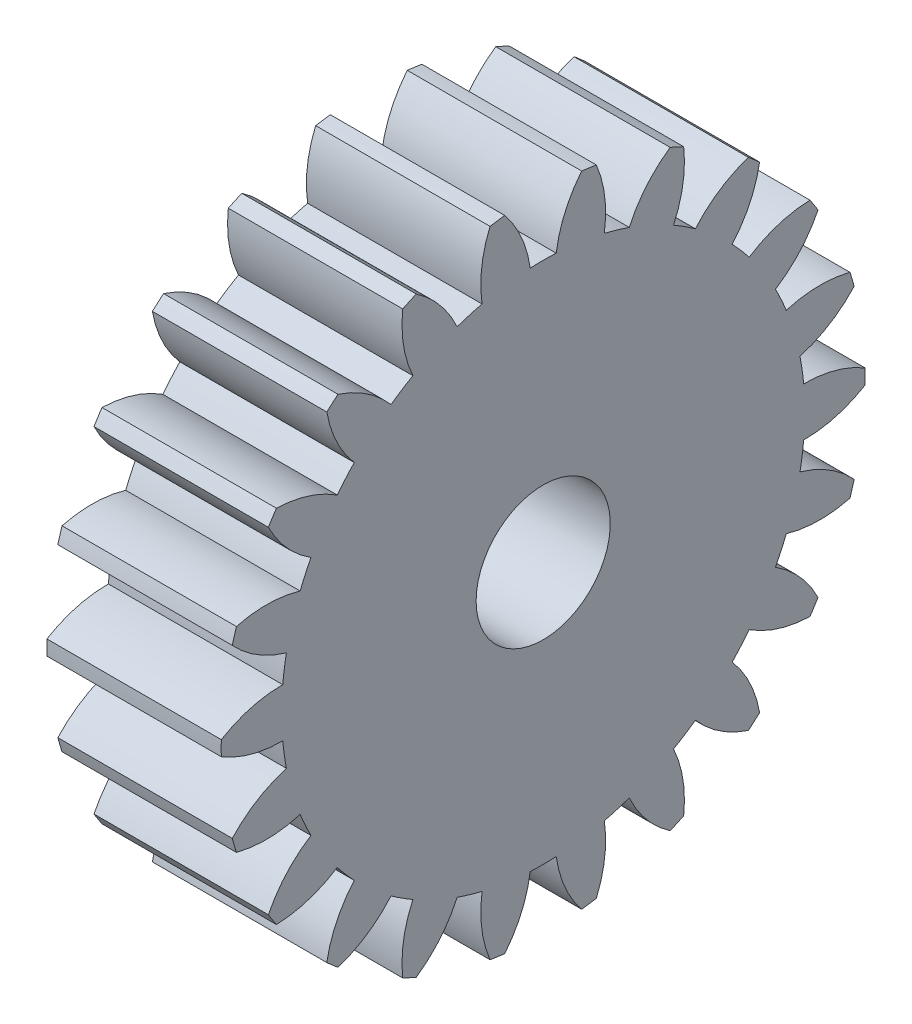
from build123d import *

# Parameters (mm, degrees)
BASPROSKE_W     = 13
BASPROSKE_H     = 24
TOOTHCUT_DEPTH  = 37.345563691
TEETHCUTS_COUNT = 22
TEETHCUTS_ANGLE = 343.636363636
BORSKE_R        = 5
BORE_DEPTH      = 50.0000508
SCALE1_SCALE    = 0.317565217


with BuildPart() as part:
    # BasProSke → Base-Revolve (revolve)
    with BuildSketch(Plane(origin=(0, 0, 0), x_dir=(1, 0, 0), z_dir=(0, 1, 0))):
        with Locations((6.5, 12)):
            Rectangle(BASPROSKE_W, BASPROSKE_H)
    revolve(axis=Axis((-10, 0, 0), (1, 0, 0)))

    # TooCutSke → ToothCut (cut, through all)
    with BuildSketch(Plane(origin=(0, 0, 0), x_dir=(0, 0, -1), z_dir=(1, 0, 0))):
        with BuildLine():
            ThreePointArc((0.968170358, 19.474949221), (0, 19.499), (-0.968170358, 19.474949221))
            ThreePointArc((-0.968170358, 19.474949221), (-1.624144469, 21.795843598), (-2.885568663, 23.851485041))
            ThreePointArc((-2.885568663, 23.851485041), (0, 24.0254), (2.885568663, 23.851485041))
            ThreePointArc((2.885568663, 23.851485041), (1.624144469, 21.795843598), (0.968170358, 19.474949221))
        make_face()
    toothcut = extrude(amount=TOOTHCUT_DEPTH, mode=Mode.SUBTRACT)

    # TeethCuts: ToothCut ×22 about axis
    teethcuts_axis = Axis((-10, 0, 0), (1, 0, 0))
    for i in range(1, TEETHCUTS_COUNT):
        add(toothcut.rotate(teethcuts_axis, i * TEETHCUTS_ANGLE / (TEETHCUTS_COUNT - 1)), mode=Mode.SUBTRACT)

    # BorSke → Bore (cut, symmetric)
    with BuildSketch(Plane(origin=(0, 0, 0), x_dir=(0, 0, -1), z_dir=(1, 0, 0))):
        Circle(BORSKE_R)
    extrude(amount=BORE_DEPTH, both=True, mode=Mode.SUBTRACT)


with BuildPart() as part_1:
    # Scale1: scaled about (6.5, 0, 0)
    add(part.part.scale(SCALE1_SCALE).moved(Location((4.435826087, 0, 0))))


solid = part_1.part
